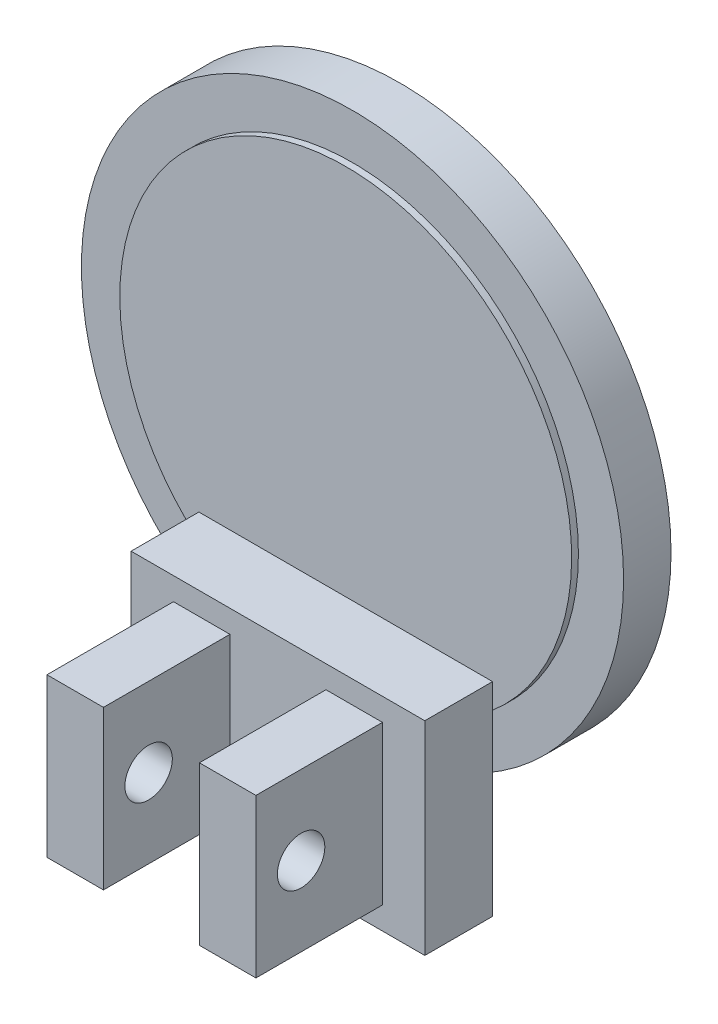
from build123d import *

# Parameters (mm, degrees)
SKETCH_1_R             = 24
F_01_DISC_D48_DEPTH    = 4.2
SKETCH_2_R             = 20
F_02_BOSS_D42_DEPTH    = 0.6
SKETCH_3_W             = 26
SKETCH_3_H             = 6
F_03_CRADLE_BASE_DEPTH = 9
SKETCH_4_W             = 5
SKETCH_4_H             = 11.2
F_04_EAR_R_DEPTH       = 7
SKETCH_5_W             = 5
SKETCH_5_H             = 11.2
F_04_EAR_L_DEPTH       = 7
SKETCH_6_R             = 2.1
F_05_PIN_HOLE_R_DEPTH  = 45.955533586
SKETCH_7_R             = 2.1
F_05_PIN_HOLE_L_DEPTH  = 45.955533586


with BuildPart() as part:
    # 草图1 → 01_DISC_D48 (new body)
    with BuildSketch(Plane.XY):
        Circle(SKETCH_1_R)
    extrude(amount=F_01_DISC_D48_DEPTH)

    # 草图2 → 02_BOSS_D42 (add)
    with BuildSketch(Plane.XY.offset(4.2)):
        Circle(SKETCH_2_R)
    extrude(amount=F_02_BOSS_D42_DEPTH)

    # 草图3 → 03_CRADLE_BASE (add, symmetric)
    with BuildSketch(Plane(origin=(0, -22, 0), x_dir=(1, 0, 0), z_dir=(0, 1, 0))):
        with Locations((0, -7.8)):
            Rectangle(SKETCH_3_W, SKETCH_3_H)
    extrude(amount=F_03_CRADLE_BASE_DEPTH, both=True)

    # 草图4 → 04_EAR_R (add, symmetric)
    with BuildSketch(Plane(origin=(0, -22, 0), x_dir=(1, 0, 0), z_dir=(0, 1, 0))):
        with Locations((6.75, -16.4)):
            Rectangle(SKETCH_4_W, SKETCH_4_H)
    extrude(amount=F_04_EAR_R_DEPTH, both=True)

    # 草图5 → 04_EAR_L (add, symmetric)
    with BuildSketch(Plane(origin=(0, -22, 0), x_dir=(1, 0, 0), z_dir=(0, 1, 0))):
        with Locations((-6.75, -16.4)):
            Rectangle(SKETCH_5_W, SKETCH_5_H)
    extrude(amount=F_04_EAR_L_DEPTH, both=True)

    # 草图6 → 05_PIN_HOLE_R (cut, through all)
    with BuildSketch(Plane(origin=(0, 0, 0), x_dir=(0, 0, -1), z_dir=(1, 0, 0))):
        with Locations((-18, -22)):
            Circle(SKETCH_6_R)
    extrude(amount=F_05_PIN_HOLE_R_DEPTH, mode=Mode.SUBTRACT)

    # 草图7 → 05_PIN_HOLE_L (cut, through all)
    with BuildSketch(Plane(origin=(0, 0, 0), x_dir=(0, 0, -1), z_dir=(1, 0, 0))):
        with Locations((-18, -22)):
            Circle(SKETCH_7_R)
    extrude(amount=-F_05_PIN_HOLE_L_DEPTH, mode=Mode.SUBTRACT)


solid = part.part
